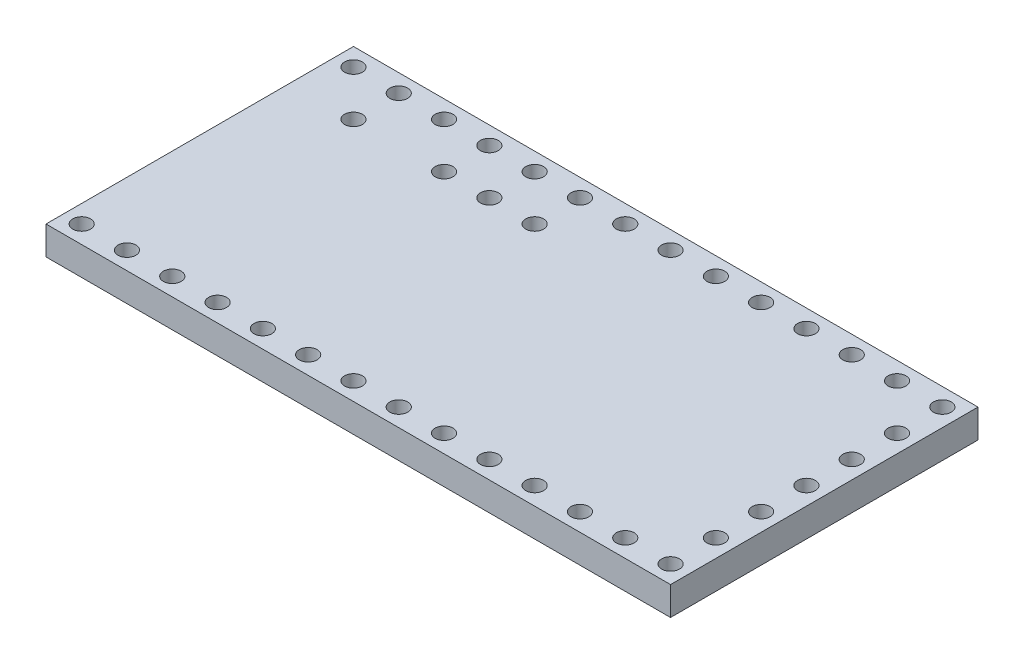
from build123d import *

# Parameters (mm, degrees)
SKETCH1_W           = 35.02
SKETCH1_H           = 17.24
BOSS_EXTRUDE1_DEPTH = 1.6
SKETCH2_R           = 0.5
CUT_EXTRUDE1_DEPTH  = 1.6
LPATTERN1_COUNT     = 14
LPATTERN1_PITCH     = 2.54
LPATTERN1_COL_COUNT = 7
LPATTERN1_COL_PITCH = 2.54
LPATTERN2_OUTLINE_R = 0.5
LPATTERN2_DEPTH     = 1.6
SKETCH3_R           = 0.5
CUT_EXTRUDE2_DEPTH  = 1.6


# Read off the part's stored shape, not the designer's step: LPattern2
with BuildPart() as part:
    # Sketch1 → Boss-Extrude1 (new body)
    with BuildSketch(Plane(origin=(0, 0, 0), x_dir=(1, 0, 0), z_dir=(0, 1, 0))):
        Rectangle(SKETCH1_W, SKETCH1_H)
    extrude(amount=BOSS_EXTRUDE1_DEPTH)

    # Sketch2 → Cut-Extrude1 (cut)
    with BuildSketch(Plane(origin=(0, 1.6, 0), x_dir=(1, 0, 0), z_dir=(0, 1, 0))):
        with Locations(Location((16.51, -7.62, 0), (0, 0, 270))):
            Circle(SKETCH2_R)
    cut_extrude1 = extrude(amount=-CUT_EXTRUDE1_DEPTH, mode=Mode.SUBTRACT)

    # LPattern1: Cut-Extrude1 ×14
    with Locations(*[(-i * LPATTERN1_PITCH, 0, 0) for i in range(1, LPATTERN1_COUNT)]):
        add(cut_extrude1, mode=Mode.SUBTRACT)

    # LPattern1 col: Cut-Extrude1 ×7
    with Locations(*[(0, 0, -i * LPATTERN1_COL_PITCH) for i in range(1, LPATTERN1_COL_COUNT)]):
        add(cut_extrude1, mode=Mode.SUBTRACT)

    # LPattern2 outline → LPattern2 (cut)
    with BuildSketch(Plane(origin=(0, 0, 0), x_dir=(1, 0, 0), z_dir=(0, 1, 0))):
        with Locations((-16.51, 7.62)):
            Circle(LPATTERN2_OUTLINE_R)
        with Locations((-13.97, 7.62)):
            Circle(LPATTERN2_OUTLINE_R)
        with Locations((-11.43, 7.62)):
            Circle(LPATTERN2_OUTLINE_R)
        with Locations((-8.89, 7.62)):
            Circle(LPATTERN2_OUTLINE_R)
        with Locations((-6.35, 7.62)):
            Circle(LPATTERN2_OUTLINE_R)
        with Locations((-3.81, 7.62)):
            Circle(LPATTERN2_OUTLINE_R)
        with Locations((-1.27, 7.62)):
            Circle(LPATTERN2_OUTLINE_R)
        with Locations((1.27, 7.62)):
            Circle(LPATTERN2_OUTLINE_R)
        with Locations((3.81, 7.62)):
            Circle(LPATTERN2_OUTLINE_R)
        with Locations((6.35, 7.62)):
            Circle(LPATTERN2_OUTLINE_R)
        with Locations((8.89, 7.62)):
            Circle(LPATTERN2_OUTLINE_R)
        with Locations((11.43, 7.62)):
            Circle(LPATTERN2_OUTLINE_R)
        with Locations((13.97, 7.62)):
            Circle(LPATTERN2_OUTLINE_R)
    extrude(amount=LPATTERN2_DEPTH, mode=Mode.SUBTRACT)

    # Sketch3 → Cut-Extrude2 (cut)
    with BuildSketch(Plane(origin=(0, 1.6, 0), x_dir=(1, 0, 0), z_dir=(0, 1, 0))):
        with Locations(Location((-13.97, 5.08, 0), (0, 0, 270))):
            Circle(SKETCH3_R)
        with Locations(Location((-8.89, 5.08, 0), (0, 0, 270))):
            Circle(SKETCH3_R)
        with Locations(Location((-6.35, 5.08, 0), (0, 0, 270))):
            Circle(SKETCH3_R)
        with Locations(Location((-3.81, 5.08, 0), (0, 0, 270))):
            Circle(SKETCH3_R)
    extrude(amount=-CUT_EXTRUDE2_DEPTH, mode=Mode.SUBTRACT)


solid = part.part
